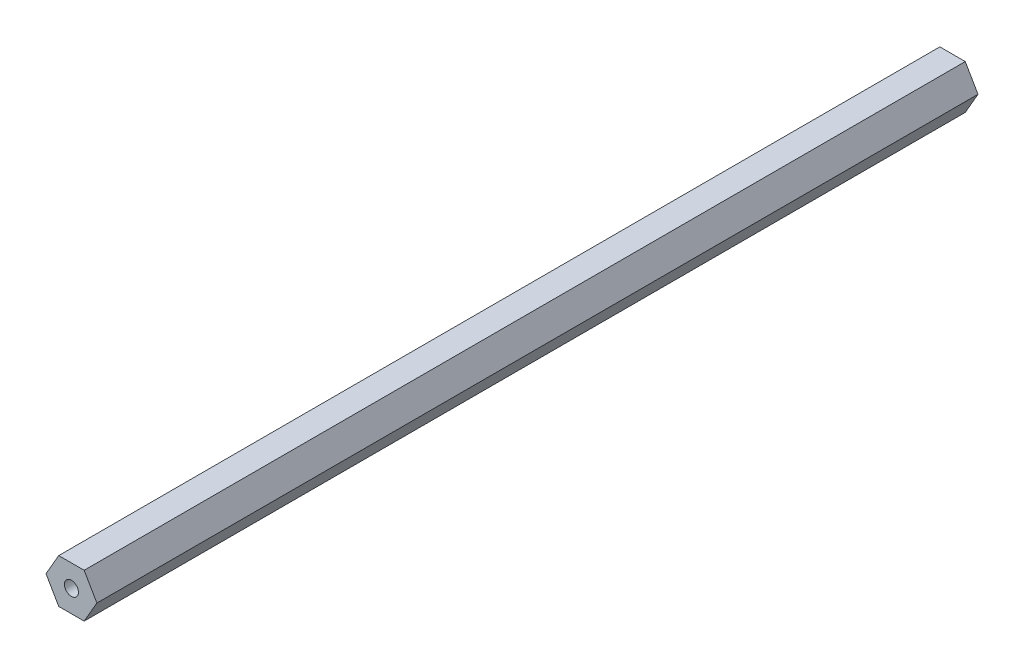
from build123d import *

# Parameters (mm, degrees)
BOSS_EXTRUDE1_DEPTH        = 254
F_10_32_TAPPED_HOLE1_D     = 4.0386
F_10_32_TAPPED_HOLE1_DEPTH = 76.2
F_10_32_TAPPED_HOLE1_TIP   = 1.213317848


with BuildPart() as part:
    # Sketch1 → Boss-Extrude1 (new body)
    with BuildSketch(Plane.XY):
        Polygon((7.332348419, 0), (3.666174209, 6.35), (-3.666174209, 6.35), (-7.332348419, 0), (-3.666174209, -6.35), (3.666174209, -6.35), align=None)
    extrude(amount=BOSS_EXTRUDE1_DEPTH)

    # #10-32 Tapped Hole1
    with Locations(Plane.XY.offset(254)):
        with Locations((0, 0)):
            Hole(F_10_32_TAPPED_HOLE1_D / 2, depth=F_10_32_TAPPED_HOLE1_DEPTH)
            with Locations((0, 0, -(F_10_32_TAPPED_HOLE1_DEPTH + F_10_32_TAPPED_HOLE1_TIP / 2))):  # 118° drill point
                Cone(0, F_10_32_TAPPED_HOLE1_D / 2, F_10_32_TAPPED_HOLE1_TIP, mode=Mode.SUBTRACT)


solid = part.part
